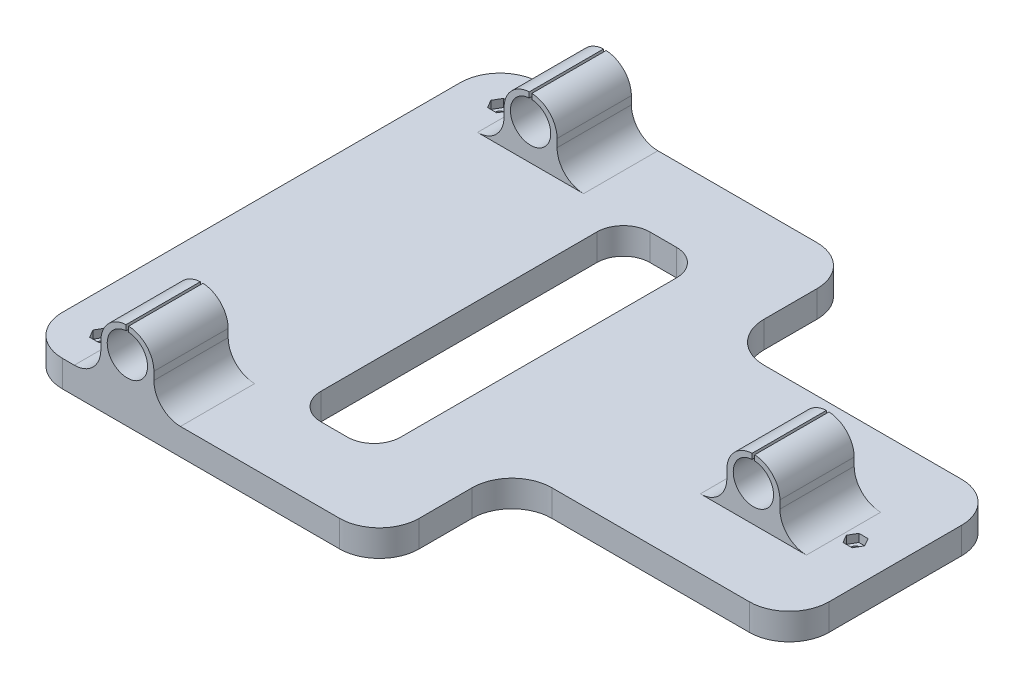
from build123d import *

# Parameters (mm, degrees)
SKETCH1_W               = 239
SKETCH1_H               = 180
SKETCH1_R               = 1.75
BOSS_EXTRUDE1_DEPTH     = 10
SKETCH2_W               = 20
SKETCH2_H               = 28
BOSS_EXTRUDE2_DEPTH     = 23
SKETCH3_R               = 7.6
CUT_EXTRUDE1_DEPTH      = 219.561776164
FILLET1_R               = 10
FILLET2_R               = 10
CUT_EXTRUDE2_DEPTH      = 20
SKETCH5_W               = 104.5
SKETCH5_H               = 50
CUT_EXTRUDE3_DEPTH      = 20
FILLET3_R               = 15
FILLET4_R               = 15
CUT_EXTRUDE4_DEPTH      = 3
SKETCH7_W               = 1
SKETCH7_H               = 35.181003967
SKETCH7_H_2             = 30.639156463
SKETCH7_H_3             = 31.227118238
CUT_EXTRUDE_THIN1_DEPTH = 21


with BuildPart() as part:
    # Sketch1 → Boss-Extrude1 (new body)
    with BuildSketch(Plane(origin=(0, 0, 0), x_dir=(1, 0, 0), z_dir=(0, 1, 0))):
        Rectangle(SKETCH1_W, SKETCH1_H)
        with Locations(Location((104.5, 0, 0), (0, 0, 270))):
            Circle(SKETCH1_R, mode=Mode.SUBTRACT)
        with Locations(Location((-104.5, 75, 0), (0, 0, 270))):
            Circle(SKETCH1_R, mode=Mode.SUBTRACT)
        with Locations(Location((-104.5, -75, 0), (0, 0, 270))):
            Circle(SKETCH1_R, mode=Mode.SUBTRACT)
    extrude(amount=BOSS_EXTRUDE1_DEPTH)

    # Sketch2 → Boss-Extrude2 (add)
    with BuildSketch(Plane(origin=(0, 10, 0), x_dir=(1, 0, 0), z_dir=(0, 1, 0))):
        with Locations((-80, 76)):
            Rectangle(SKETCH2_W, SKETCH2_H)
        with Locations((-80, -76)):
            Rectangle(SKETCH2_W, SKETCH2_H)
        with Locations((80, 0)):
            Rectangle(SKETCH2_W, SKETCH2_H)
    extrude(amount=BOSS_EXTRUDE2_DEPTH)

    # Sketch3 → Cut-Extrude1 (cut, symmetric)
    with BuildSketch(Plane(origin=(0, 0, -90), x_dir=(-1, 0, 0), z_dir=(0, 0, -1))):
        with Locations((80, 23.4)):
            Circle(SKETCH3_R)
    cut_extrude1 = extrude(amount=CUT_EXTRUDE1_DEPTH, both=True, mode=Mode.SUBTRACT)

    # Fillet1
    fillet1_edges = [part.edges().sort_by_distance(p)[0] for p in [
        (90, 33, 0),
        (70, 33, 0),
        (-90, 33, 76),
        (-70, 33, 76),
        (-70, 33, -76),
        (-90, 33, -76),
    ]]
    fillet(fillet1_edges, radius=FILLET1_R - 0.0001)  # a hair under: the kernel refuses the full size

    # Mirror1: Cut-Extrude1 across plane
    add(cut_extrude1.mirror(Plane(origin=(0, 0, 0), x_dir=(0, 0, 1), z_dir=(1, 0, 0))), mode=Mode.SUBTRACT)

    # Fillet2
    fillet2_edges = [part.edges().sort_by_distance(p)[0] for p in [
        (-70, 10, -76),
        (-90, 10, -76),
        (-70, 10, 76),
        (-90, 10, 76),
        (70, 10, 0),
        (90, 10, 0),
    ]]
    fillet(fillet2_edges, radius=FILLET2_R)

    # Sketch4 → Cut-Extrude2 (cut)
    with BuildSketch(Plane(origin=(0, 10, 0), x_dir=(1, 0, 0), z_dir=(0, 1, 0))):
        with BuildLine():
            Line((-35, 62), (-25, 62))
            ThreePointArc((-25, 62), (-17.928932188, 59.071067812), (-15, 52))
            Line((-15, 52), (-15, -52))
            ThreePointArc((-15, -52), (-17.928932188, -59.071067812), (-25, -62))
            Line((-25, -62), (-35, -62))
            ThreePointArc((-35, -62), (-42.071067812, -59.071067812), (-45, -52))
            Line((-45, -52), (-45, 52))
            ThreePointArc((-45, 52), (-42.071067812, 59.071067812), (-35, 62))
        make_face()
    extrude(amount=-CUT_EXTRUDE2_DEPTH, mode=Mode.SUBTRACT)

    # Sketch5 → Cut-Extrude3 (cut)
    with BuildSketch(Plane(origin=(0, 10, 0), x_dir=(1, 0, 0), z_dir=(0, 1, 0))):
        with Locations((67.25, 65)):
            Rectangle(SKETCH5_W, SKETCH5_H)
    cut_extrude3 = extrude(amount=-CUT_EXTRUDE3_DEPTH, mode=Mode.SUBTRACT)

    # Fillet3
    fillet3_edges = [part.edges().sort_by_distance(p)[0] for p in [
        (15, 5, -90),
        (119.5, 5, -40),
        (15, 5, -40),
        (-119.5, 5, -90),
    ]]
    fillet(fillet3_edges, radius=FILLET3_R)

    # Mirror2: Cut-Extrude3 across plane
    add(cut_extrude3.mirror(Plane.XY), mode=Mode.SUBTRACT)

    # Fillet4
    fillet4_edges = [part.edges().sort_by_distance(p)[0] for p in [
        (15, 5, 90),
        (119.5, 5, 40),
        (15, 5, 40),
        (-119.5, 5, 90),
    ]]
    fillet(fillet4_edges, radius=FILLET4_R)

    # Sketch6 → Cut-Extrude4 (cut)
    with BuildSketch(Plane(origin=(0, 10, 0), x_dir=(1, 0, 0), z_dir=(0, 1, 0))):
        Polygon((-107.964101615, -75), (-106.232050808, -78), (-102.767949192, -78), (-101.035898385, -75), (-102.767949192, -72), (-106.232050808, -72), align=None)
        Polygon((-107.964101615, 75), (-106.232050808, 72), (-102.767949192, 72), (-101.035898385, 75), (-102.767949192, 78), (-106.232050808, 78), align=None)
        Polygon((107.964101615, 0), (106.232050808, 3), (102.767949192, 3), (101.035898385, 0), (102.767949192, -3), (106.232050808, -3), align=None)
    extrude(amount=-CUT_EXTRUDE4_DEPTH, mode=Mode.SUBTRACT)

    # Sketch7 → Cut-Extrude-Thin1 (cut)
    with BuildSketch(Plane(origin=(0, 25, 0), x_dir=(1, 0, 0), z_dir=(0, 1, 0))):
        with Locations((-80, -79.590501984)):
            Rectangle(SKETCH7_W, SKETCH7_H)
        with Locations((-80, 74.680421768)):
            Rectangle(SKETCH7_W, SKETCH7_H_2)
        with Locations((80, -1.613559119)):
            Rectangle(SKETCH7_W, SKETCH7_H_3)
    extrude(amount=CUT_EXTRUDE_THIN1_DEPTH, mode=Mode.SUBTRACT)


solid = part.part
